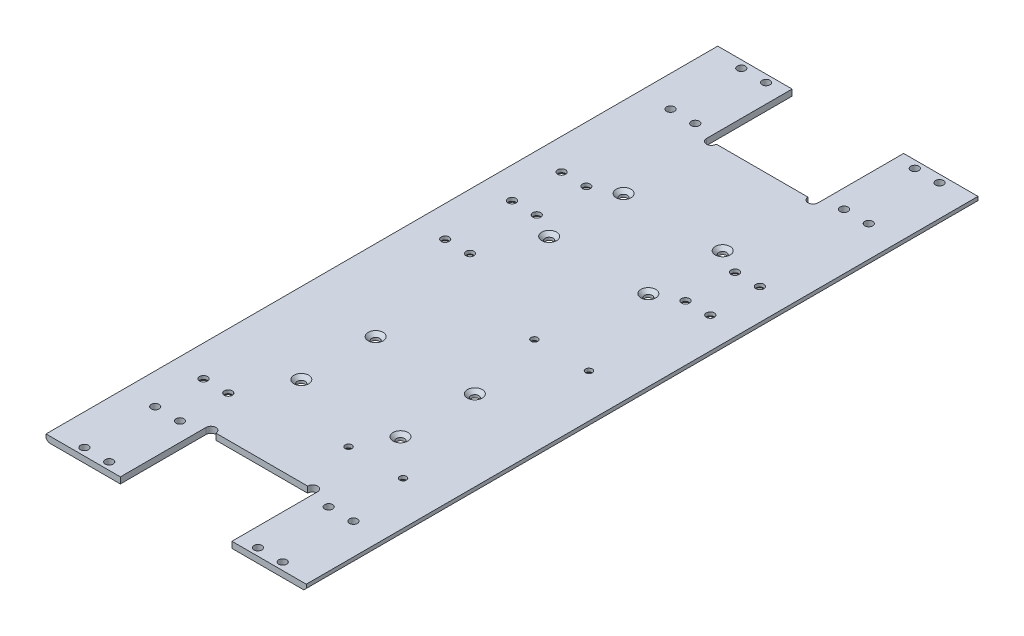
from build123d import *

# Parameters (mm, degrees)
SKETCH_1_W          = 105
SKETCH_1_H          = 271
EXTRUDE_1_DEPTH     = 2.5
SKETCH_2_R          = 1.35
SKETCH_2_R_2        = 1.6
CUT_EXTRUDE_1_DEPTH = 10
CHAMFER_4_SIZE      = 1.4
CHAMFER_5_SIZE      = 1
CUT_EXTRUDE_2_DEPTH = 10
SKETCH_6_R          = 1.6
CUT_EXTRUDE_3_DEPTH = 10
SKETCH_7_R          = 1.6
CUT_EXTRUDE_4_DEPTH = 10
SKETCH_8_R          = 1.6
CUT_EXTRUDE_5_DEPTH = 10
SKETCH_9_R          = 2
CUT_EXTRUDE_6_DEPTH = 10
CHAMFER_3_SIZE      = 1.15


with BuildPart() as part:
    # 草图1 → 凸台-拉伸1 (new body)
    with BuildSketch(Plane(origin=(0, 0, 0), x_dir=(1, 0, 0), z_dir=(0, 1, 0))):
        Rectangle(SKETCH_1_W, SKETCH_1_H)
    extrude(amount=EXTRUDE_1_DEPTH)

    # 草图2 → 切除-拉伸1 (cut)
    with BuildSketch(Plane(origin=(0, 2.5, 0), x_dir=(1, 0, 0), z_dir=(0, 1, 0))):
        with Locations((35, -3.95)):
            Circle(SKETCH_2_R)
        with Locations((13.000000181, -3.95)):
            Circle(SKETCH_2_R)
        with Locations((35, -78.95)):
            Circle(SKETCH_2_R)
        with Locations((13.000000181, -78.95)):
            Circle(SKETCH_2_R)
        with Locations((20, -35)):
            Circle(SKETCH_2_R_2)
        with Locations((-20, -35)):
            Circle(SKETCH_2_R_2)
        with Locations((20, -65)):
            Circle(SKETCH_2_R_2)
        with Locations((-20, -65)):
            Circle(SKETCH_2_R_2)
        with Locations((-20, 35)):
            Circle(SKETCH_2_R_2)
        with Locations((20, 35)):
            Circle(SKETCH_2_R_2)
        with Locations((-20, 65)):
            Circle(SKETCH_2_R_2)
        with Locations((20, 65)):
            Circle(SKETCH_2_R_2)
    extrude(amount=-CUT_EXTRUDE_1_DEPTH, mode=Mode.SUBTRACT)

    # 倒角4
    chamfer_4_edges = [part.edges().sort_by_distance(p)[0] for p in [
        (-21.6, 2.5, 65),
        (-21.6, 2.5, 35),
        (18.4, 2.5, 65),
        (18.4, 2.5, 35),
        (-21.6, 2.5, -35),
        (-21.6, 2.5, -65),
        (18.4, 2.5, -35),
        (18.4, 2.5, -65),
    ]]
    chamfer(chamfer_4_edges, length=CHAMFER_4_SIZE)

    # 倒角5
    chamfer_5_edges = [part.edges().sort_by_distance(p)[0] for p in [
        (52.5, 0, 0),
        (-52.5, 0, 0),
    ]]
    chamfer(chamfer_5_edges, length=CHAMFER_5_SIZE)

    # 草图4 → 切除-拉伸2 (cut)
    with BuildSketch(Plane.XZ):
        Polygon((0, 100.95), (22.5, 100.95), (22.5, 135.5), (-22.5, 135.5), (-22.5, 100.95), align=None)
        Polygon((-22.5, -100.95), (0, -100.95), (22.5, -100.95), (22.5, -135.5), (-22.5, -135.5), align=None)
    extrude(amount=-CUT_EXTRUDE_2_DEPTH, mode=Mode.SUBTRACT)

    # 草图6 → 切除-拉伸3 (cut)
    with BuildSketch(Plane.XZ):
        with Locations((-40, 132.5)):
            Circle(SKETCH_6_R)
        with Locations((-30, 132.5)):
            Circle(SKETCH_6_R)
        with Locations((-30, 103.95)):
            Circle(SKETCH_6_R)
        with Locations((-40, 103.95)):
            Circle(SKETCH_6_R)
        with Locations((40, 103.95)):
            Circle(SKETCH_6_R)
        with Locations((30, 103.95)):
            Circle(SKETCH_6_R)
        with Locations((30, 132.5)):
            Circle(SKETCH_6_R)
        with Locations((40, 132.5)):
            Circle(SKETCH_6_R)
        with Locations((40, -132.5)):
            Circle(SKETCH_6_R)
        with Locations((30, -132.5)):
            Circle(SKETCH_6_R)
        with Locations((30, -103.95)):
            Circle(SKETCH_6_R)
        with Locations((40, -103.95)):
            Circle(SKETCH_6_R)
        with Locations((-40, -103.95)):
            Circle(SKETCH_6_R)
        with Locations((-30, -103.95)):
            Circle(SKETCH_6_R)
        with Locations((-30, -132.5)):
            Circle(SKETCH_6_R)
        with Locations((-40, -132.5)):
            Circle(SKETCH_6_R)
    extrude(amount=-CUT_EXTRUDE_3_DEPTH, mode=Mode.SUBTRACT)

    # 草图7 → 切除-拉伸4 (cut)
    with BuildSketch(Plane(origin=(0, 2.5, 0), x_dir=(1, 0, 0), z_dir=(0, 1, 0))):
        with Locations((-40, 60)):
            Circle(SKETCH_7_R)
        with Locations((-30, 60)):
            Circle(SKETCH_7_R)
        with Locations((30, 60)):
            Circle(SKETCH_7_R)
        with Locations((40, 60)):
            Circle(SKETCH_7_R)
        with Locations((-40, 40)):
            Circle(SKETCH_7_R)
        with Locations((-30, 40)):
            Circle(SKETCH_7_R)
        with Locations((30, 40)):
            Circle(SKETCH_7_R)
        with Locations((40, 40)):
            Circle(SKETCH_7_R)
    extrude(amount=-CUT_EXTRUDE_4_DEPTH, mode=Mode.SUBTRACT)

    # 草图8 → 切除-拉伸5 (cut)
    with BuildSketch(Plane.XZ):
        with Locations((-40, 84.45)):
            Circle(SKETCH_8_R)
        with Locations((-30, 84.45)):
            Circle(SKETCH_8_R)
        with Locations((-40, -13.05)):
            Circle(SKETCH_8_R)
        with Locations((-30, -13.05)):
            Circle(SKETCH_8_R)
    extrude(amount=-CUT_EXTRUDE_5_DEPTH, mode=Mode.SUBTRACT)

    # 草图9 → 切除-拉伸6 (cut)
    with BuildSketch(Plane.XZ):
        with Locations((20.5, 100.95)):
            Circle(SKETCH_9_R)
        with Locations((-20.5, 100.95)):
            Circle(SKETCH_9_R)
        with Locations((-20.5, -100.95)):
            Circle(SKETCH_9_R)
        with Locations((20.5, -100.95)):
            Circle(SKETCH_9_R)
    extrude(amount=-CUT_EXTRUDE_6_DEPTH, mode=Mode.SUBTRACT)

    # 倒角3
    chamfer_3_edges = [part.edges().sort_by_distance(p)[0] for p in [
        (11.650000181, 0, 3.95),
        (33.65, 0, 3.95),
        (33.65, 0, 78.95),
        (11.650000181, 0, 78.95),
        (38.4, 0, -60),
        (28.4, 0, -60),
        (-31.6, 0, -60),
        (-41.6, 0, -60),
        (-31.6, 0, -13.05),
        (-41.6, 0, -13.05),
        (-31.6, 0, 84.45),
        (-41.6, 0, 84.45),
        (-41.6, 0, -40),
        (-31.6, 0, -40),
        (28.4, 0, -40),
        (38.4, 0, -40),
    ]]
    chamfer(chamfer_3_edges, length=CHAMFER_3_SIZE)


solid = part.part
